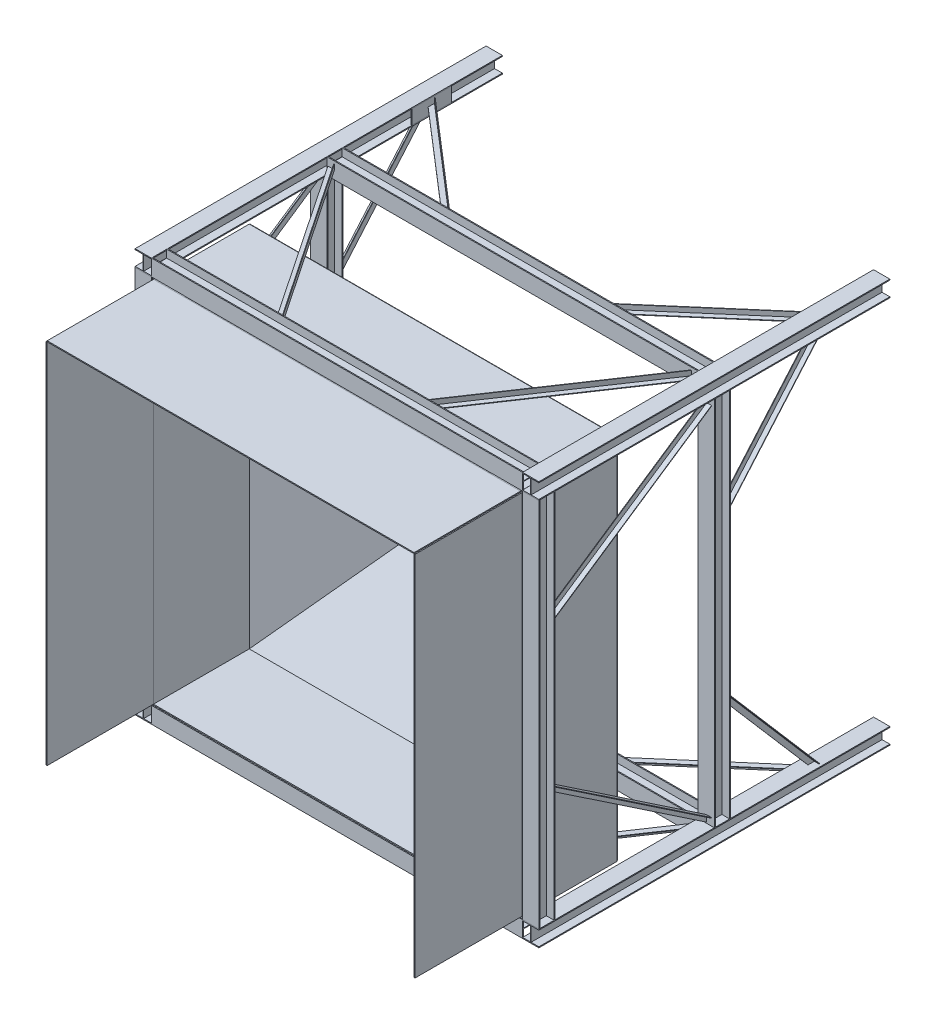
from build123d import *

# Parameters (mm, degrees)
COLUMNA_H_1_DEPTH                            = 3300
COLUMNA_H_2_DEPTH                            = 3300
COLUMNA_H_3_DEPTH                            = 3300
COLUMNA_H_4_DEPTH                            = 3300
VIGA_H_CARGA_1650_DEPTH                      = 3490
VIGA_H_CARGA_3300_DEPTH                      = 3490
CONTORNO_CIERRE_COLUMNA_CARGA_A_W            = 370
CONTORNO_CIERRE_COLUMNA_CARGA_A_H            = 135
CIERRE_COLUMNA_CARGA_A_DEPTH                 = 8
ALA_PLANA_ANGULAR_SUPERIOR_CARGA_A_DEPTH     = 5
RETORNO_ANGULAR_SUPERIOR_CARGA_A_DEPTH       = 45
ALA_PLANA_ANGULAR_INFERIOR_CARGA_A_DEPTH     = 5
RETORNO_ANGULAR_INFERIOR_CARGA_A_DEPTH       = 45
CONTORNO_CIERRE_COLUMNA_CARGA_B_W            = 370
CONTORNO_CIERRE_COLUMNA_CARGA_B_H            = 135
CIERRE_COLUMNA_CARGA_B_DEPTH                 = 8
ALA_PLANA_ANGULAR_SUPERIOR_CARGA_B_DEPTH     = 5
RETORNO_ANGULAR_SUPERIOR_CARGA_B_DEPTH       = 45
ALA_PLANA_ANGULAR_INFERIOR_CARGA_B_DEPTH     = 5
RETORNO_ANGULAR_INFERIOR_CARGA_B_DEPTH       = 45
CONTORNO_ASIENTO_SOLDADO_CARGA_W             = 2900
CONTORNO_ASIENTO_SOLDADO_CARGA_H             = 83.725
ASIENTO_SOLDADO_CARGA_DEPTH                  = 9.525
VIGA_H_FONDO_1650_DEPTH                      = 3490
VIGA_H_FONDO_3300_DEPTH                      = 3490
CONTORNO_CIERRE_COLUMNA_FONDO_A_W            = 370
CONTORNO_CIERRE_COLUMNA_FONDO_A_H            = 135
CIERRE_COLUMNA_FONDO_A_DEPTH                 = 8
ALA_PLANA_ANGULAR_SUPERIOR_FONDO_A_DEPTH     = 5
RETORNO_ANGULAR_SUPERIOR_FONDO_A_DEPTH       = 45
ALA_PLANA_ANGULAR_INFERIOR_FONDO_A_DEPTH     = 5
RETORNO_ANGULAR_INFERIOR_FONDO_A_DEPTH       = 45
CONTORNO_CIERRE_COLUMNA_FONDO_B_W            = 370
CONTORNO_CIERRE_COLUMNA_FONDO_B_H            = 135
CIERRE_COLUMNA_FONDO_B_DEPTH                 = 8
ALA_PLANA_ANGULAR_SUPERIOR_FONDO_B_DEPTH     = 5
RETORNO_ANGULAR_SUPERIOR_FONDO_B_DEPTH       = 45
ALA_PLANA_ANGULAR_INFERIOR_FONDO_B_DEPTH     = 5
RETORNO_ANGULAR_INFERIOR_FONDO_B_DEPTH       = 45
CONTORNO_ASIENTO_SOLDADO_FONDO_W             = 2900
CONTORNO_ASIENTO_SOLDADO_FONDO_H             = 83.725
ASIENTO_SOLDADO_FONDO_DEPTH                  = 9.525
VIGA_H_IZQUIERDA_1650_DEPTH                  = 3490
VIGA_H_IZQUIERDA_3300_DEPTH                  = 3490
ALA_PLANA_ANGULAR_SUPERIOR_IZQUIERDA_A_DEPTH = 5
RETORNO_ANGULAR_SUPERIOR_IZQUIERDA_A_DEPTH   = 45
ALA_PLANA_ANGULAR_INFERIOR_IZQUIERDA_A_DEPTH = 5
RETORNO_ANGULAR_INFERIOR_IZQUIERDA_A_DEPTH   = 45
ALA_PLANA_ANGULAR_SUPERIOR_IZQUIERDA_B_DEPTH = 5
RETORNO_ANGULAR_SUPERIOR_IZQUIERDA_B_DEPTH   = 45
ALA_PLANA_ANGULAR_INFERIOR_IZQUIERDA_B_DEPTH = 5
RETORNO_ANGULAR_INFERIOR_IZQUIERDA_B_DEPTH   = 45
CONTORNO_ASIENTO_SOLDADO_IZQUIERDA_W         = 83.725
CONTORNO_ASIENTO_SOLDADO_IZQUIERDA_H         = 2900
ASIENTO_SOLDADO_IZQUIERDA_DEPTH              = 9.525
VIGA_H_DERECHA_1650_DEPTH                    = 3490
VIGA_H_DERECHA_3300_DEPTH                    = 3490
ALA_PLANA_ANGULAR_SUPERIOR_DERECHA_A_DEPTH   = 5
RETORNO_ANGULAR_SUPERIOR_DERECHA_A_DEPTH     = 45
ALA_PLANA_ANGULAR_INFERIOR_DERECHA_A_DEPTH   = 5
RETORNO_ANGULAR_INFERIOR_DERECHA_A_DEPTH     = 45
ALA_PLANA_ANGULAR_SUPERIOR_DERECHA_B_DEPTH   = 5
RETORNO_ANGULAR_SUPERIOR_DERECHA_B_DEPTH     = 45
ALA_PLANA_ANGULAR_INFERIOR_DERECHA_B_DEPTH   = 5
RETORNO_ANGULAR_INFERIOR_DERECHA_B_DEPTH     = 45
CONTORNO_ASIENTO_SOLDADO_DERECHA_W           = 83.725
CONTORNO_ASIENTO_SOLDADO_DERECHA_H           = 2900
ASIENTO_SOLDADO_DERECHA_DEPTH                = 9.525
CONTORNO_COLLAR_CARGA_W                      = 3450
CONTORNO_COLLAR_CARGA_H                      = 900
COLLAR_CARGA_DEPTH                           = 9.525
EMBUDO_CARGA_DEPTH                           = 9.525
CONTORNO_COLLAR_DERECHA_W                    = 900
CONTORNO_COLLAR_DERECHA_H                    = 3450
COLLAR_DERECHA_DEPTH                         = 9.525
CONTORNO_ALER_N_DERECHA_W                    = 1000
CONTORNO_ALER_N_DERECHA_H                    = 3450
ALER_N_DERECHA_DEPTH                         = 9.525
EMBUDO_DERECHA_DEPTH                         = 9.525
CONTORNO_COLLAR_FONDO_W                      = 3450
CONTORNO_COLLAR_FONDO_H                      = 900
COLLAR_FONDO_DEPTH                           = 9.525
CONTORNO_ALER_N_FONDO_W                      = 3450
CONTORNO_ALER_N_FONDO_H                      = 1000
ALER_N_FONDO_DEPTH                           = 9.525
EMBUDO_FONDO_DEPTH                           = 9.525
CONTORNO_COLLAR_IZQUIERDA_W                  = 900
CONTORNO_COLLAR_IZQUIERDA_H                  = 3450
COLLAR_IZQUIERDA_DEPTH                       = 9.525
CONTORNO_ALER_N_IZQUIERDA_W                  = 1000
CONTORNO_ALER_N_IZQUIERDA_H                  = 3450
ALER_N_IZQUIERDA_DEPTH                       = 9.525
EMBUDO_IZQUIERDA_DEPTH                       = 9.525


with BuildPart() as part:
    # Contorno Columna H 1 → Columna H 1 (new body)
    with BuildSketch(Plane.XY):
        Polygon((-1898, -1898), (-1745, -1898), (-1745, -1889), (-1818.25, -1889), (-1818.25, -1754), (-1745, -1754), (-1745, -1745), (-1898, -1745), (-1898, -1754), (-1824.75, -1754), (-1824.75, -1889), (-1898, -1889), align=None)
    extrude(amount=COLUMNA_H_1_DEPTH)


with BuildPart() as body_2:
    # Contorno Columna H 2 → Columna H 2 (new body)
    with BuildSketch(Plane.XY):
        Polygon((-1898, 1745), (-1745, 1745), (-1745, 1754), (-1818.25, 1754), (-1818.25, 1889), (-1745, 1889), (-1745, 1898), (-1898, 1898), (-1898, 1889), (-1824.75, 1889), (-1824.75, 1754), (-1898, 1754), align=None)
    extrude(amount=COLUMNA_H_2_DEPTH)


with BuildPart() as body_3:
    # Contorno Columna H 3 → Columna H 3 (new body)
    with BuildSketch(Plane.XY):
        Polygon((1745, -1898), (1898, -1898), (1898, -1889), (1824.75, -1889), (1824.75, -1754), (1898, -1754), (1898, -1745), (1745, -1745), (1745, -1754), (1818.25, -1754), (1818.25, -1889), (1745, -1889), align=None)
    extrude(amount=COLUMNA_H_3_DEPTH)


with BuildPart() as body_4:
    # Contorno Columna H 4 → Columna H 4 (new body)
    with BuildSketch(Plane.XY):
        Polygon((1745, 1745), (1898, 1745), (1898, 1754), (1824.75, 1754), (1824.75, 1889), (1898, 1889), (1898, 1898), (1745, 1898), (1745, 1889), (1818.25, 1889), (1818.25, 1754), (1745, 1754), align=None)
    extrude(amount=COLUMNA_H_4_DEPTH)


with BuildPart() as body_5:
    # Contorno Viga H carga 1650 → Viga H carga 1650 (new body)
    with BuildSketch(Plane(origin=(-1745, 0, 0), x_dir=(0, 0, -1), z_dir=(1, 0, 0))):
        Polygon((-1497, -1745), (-1497, -1898), (-1506, -1898), (-1506, -1824.75), (-1641, -1824.75), (-1641, -1898), (-1650, -1898), (-1650, -1745), (-1641, -1745), (-1641, -1818.25), (-1506, -1818.25), (-1506, -1745), align=None)
    extrude(amount=VIGA_H_CARGA_1650_DEPTH)


with BuildPart() as body_6:
    # Contorno Viga H carga 3300 → Viga H carga 3300 (new body)
    with BuildSketch(Plane(origin=(-1745, 0, 0), x_dir=(0, 0, -1), z_dir=(1, 0, 0))):
        Polygon((-3147, -1745), (-3147, -1898), (-3156, -1898), (-3156, -1824.75), (-3291, -1824.75), (-3291, -1898), (-3300, -1898), (-3300, -1745), (-3291, -1745), (-3291, -1818.25), (-3156, -1818.25), (-3156, -1745), align=None)
    extrude(amount=VIGA_H_CARGA_3300_DEPTH)


with BuildPart() as body_7:
    # Contorno Cierre columna carga A → Cierre columna carga A (new body)
    with BuildSketch(Plane(origin=(-1745, 0, 0), x_dir=(0, 0, -1), z_dir=(1, 0, 0))):
        with Locations((-665, -1821.5)):
            Rectangle(CONTORNO_CIERRE_COLUMNA_CARGA_A_W, CONTORNO_CIERRE_COLUMNA_CARGA_A_H)
    extrude(amount=-CIERRE_COLUMNA_CARGA_A_DEPTH)


with BuildPart() as body_8:
    # Contorno Ala plana Angular superior carg → Ala plana Angular superior carga A (new body)
    with BuildSketch(Plane(origin=(0, -1821.5, 0), x_dir=(1, 0, 0), z_dir=(0, 1, 0))):
        Polygon((-1674.870108064, -1650), (-1735.129891936, -1650), (-728.129891936, -3147), (-667.870108064, -3147), align=None)
    extrude(amount=-ALA_PLANA_ANGULAR_SUPERIOR_CARGA_A_DEPTH)


with BuildPart() as body_9:
    # Contorno Retorno Angular superior carga → Retorno Angular superior carga A (new body)
    with BuildSketch(Plane(origin=(0, -1826.5, 0), x_dir=(1, 0, 0), z_dir=(0, 1, 0))):
        Polygon((-1674.870108064, -1650), (-1680.896086451, -1650), (-673.896086451, -3147), (-667.870108064, -3147), align=None)
    extrude(amount=-RETORNO_ANGULAR_SUPERIOR_CARGA_A_DEPTH)


with BuildPart() as body_8_1:
    add(body_8.part)

    # Angular superior carga A: union body 9
    add(body_9.part)


with BuildPart() as body_9_2:
    # Contorno Ala plana Angular inferior carg → Ala plana Angular inferior carga A (new body)
    with BuildSketch(Plane(origin=(0, -1821.5, 0), x_dir=(1, 0, 0), z_dir=(0, 1, 0))):
        Polygon((-1745, -631.991026401), (-1745, -698.008973599), (-818.285648465, -1497), (-741.714351535, -1497), align=None)
    extrude(amount=-ALA_PLANA_ANGULAR_INFERIOR_CARGA_A_DEPTH)


with BuildPart() as body_10:
    # Contorno Retorno Angular inferior carga → Retorno Angular inferior carga A (new body)
    with BuildSketch(Plane(origin=(0, -1826.5, 0), x_dir=(1, 0, 0), z_dir=(0, 1, 0))):
        Polygon((-1745, -631.991026401), (-1745, -638.592821121), (-749.371481228, -1497), (-741.714351535, -1497), align=None)
    extrude(amount=-RETORNO_ANGULAR_INFERIOR_CARGA_A_DEPTH)


with BuildPart() as body_9_2_1:
    add(body_9_2.part)

    # Angular inferior carga A: union body 10
    add(body_10.part)


with BuildPart() as body_10_2:
    # Contorno Cierre columna carga B → Cierre columna carga B (new body)
    with BuildSketch(Plane(origin=(1745, 0, 0), x_dir=(0, 0, -1), z_dir=(1, 0, 0))):
        with Locations((-665, -1821.5)):
            Rectangle(CONTORNO_CIERRE_COLUMNA_CARGA_B_W, CONTORNO_CIERRE_COLUMNA_CARGA_B_H)
    extrude(amount=CIERRE_COLUMNA_CARGA_B_DEPTH)


with BuildPart() as body_11:
    # Contorno Ala plana Angular superior  2 → Ala plana Angular superior carga B (new body)
    with BuildSketch(Plane(origin=(0, -1821.5, 0), x_dir=(1, 0, 0), z_dir=(0, 1, 0))):
        Polygon((1674.870108064, -1650), (1735.129891936, -1650), (728.129891936, -3147), (667.870108064, -3147), align=None)
    extrude(amount=-ALA_PLANA_ANGULAR_SUPERIOR_CARGA_B_DEPTH)


with BuildPart() as body_12:
    # Contorno Retorno Angular superior ca 2 → Retorno Angular superior carga B (new body)
    with BuildSketch(Plane(origin=(0, -1826.5, 0), x_dir=(1, 0, 0), z_dir=(0, 1, 0))):
        Polygon((1674.870108064, -1650), (1680.896086451, -1650), (673.896086451, -3147), (667.870108064, -3147), align=None)
    extrude(amount=-RETORNO_ANGULAR_SUPERIOR_CARGA_B_DEPTH)


with BuildPart() as body_11_1:
    add(body_11.part)

    # Angular superior carga B: union body 12
    add(body_12.part)


with BuildPart() as body_12_2:
    # Contorno Ala plana Angular inferior  2 → Ala plana Angular inferior carga B (new body)
    with BuildSketch(Plane(origin=(0, -1821.5, 0), x_dir=(1, 0, 0), z_dir=(0, 1, 0))):
        Polygon((1745, -631.991026401), (1745, -698.008973599), (818.285648465, -1497), (741.714351535, -1497), align=None)
    extrude(amount=-ALA_PLANA_ANGULAR_INFERIOR_CARGA_B_DEPTH)


with BuildPart() as body_13:
    # Contorno Retorno Angular inferior ca 2 → Retorno Angular inferior carga B (new body)
    with BuildSketch(Plane(origin=(0, -1826.5, 0), x_dir=(1, 0, 0), z_dir=(0, 1, 0))):
        Polygon((1745, -631.991026401), (1745, -638.592821121), (749.371481228, -1497), (741.714351535, -1497), align=None)
    extrude(amount=-RETORNO_ANGULAR_INFERIOR_CARGA_B_DEPTH)


with BuildPart() as body_12_2_1:
    add(body_12_2.part)

    # Angular inferior carga B: union body 13
    add(body_13.part)


with BuildPart() as body_13_2:
    # Contorno Asiento soldado carga → Asiento soldado carga (new body)
    with BuildSketch(Plane.XY.offset(3281.475)):
        with Locations((0, -1776.3875)):
            Rectangle(CONTORNO_ASIENTO_SOLDADO_CARGA_W, CONTORNO_ASIENTO_SOLDADO_CARGA_H)
    extrude(amount=ASIENTO_SOLDADO_CARGA_DEPTH)


with BuildPart() as body_14:
    # Contorno Viga H fondo 1650 → Viga H fondo 1650 (new body)
    with BuildSketch(Plane(origin=(-1745, 0, 0), x_dir=(0, 0, -1), z_dir=(1, 0, 0))):
        Polygon((-1497, 1745), (-1497, 1898), (-1506, 1898), (-1506, 1824.75), (-1641, 1824.75), (-1641, 1898), (-1650, 1898), (-1650, 1745), (-1641, 1745), (-1641, 1818.25), (-1506, 1818.25), (-1506, 1745), align=None)
    extrude(amount=VIGA_H_FONDO_1650_DEPTH)


with BuildPart() as body_15:
    # Contorno Viga H fondo 3300 → Viga H fondo 3300 (new body)
    with BuildSketch(Plane(origin=(-1745, 0, 0), x_dir=(0, 0, -1), z_dir=(1, 0, 0))):
        Polygon((-3147, 1745), (-3147, 1898), (-3156, 1898), (-3156, 1824.75), (-3291, 1824.75), (-3291, 1898), (-3300, 1898), (-3300, 1745), (-3291, 1745), (-3291, 1818.25), (-3156, 1818.25), (-3156, 1745), align=None)
    extrude(amount=VIGA_H_FONDO_3300_DEPTH)


with BuildPart() as body_16:
    # Contorno Cierre columna fondo A → Cierre columna fondo A (new body)
    with BuildSketch(Plane(origin=(-1745, 0, 0), x_dir=(0, 0, -1), z_dir=(1, 0, 0))):
        with Locations((-665, 1821.5)):
            Rectangle(CONTORNO_CIERRE_COLUMNA_FONDO_A_W, CONTORNO_CIERRE_COLUMNA_FONDO_A_H)
    extrude(amount=-CIERRE_COLUMNA_FONDO_A_DEPTH)


with BuildPart() as body_17:
    # Contorno Ala plana Angular superior fond → Ala plana Angular superior fondo A (new body)
    with BuildSketch(Plane(origin=(0, 1821.5, 0), x_dir=(1, 0, 0), z_dir=(0, 1, 0))):
        Polygon((-1674.870108064, -1650), (-1735.129891936, -1650), (-728.129891936, -3147), (-667.870108064, -3147), align=None)
    extrude(amount=ALA_PLANA_ANGULAR_SUPERIOR_FONDO_A_DEPTH)


with BuildPart() as body_18:
    # Contorno Retorno Angular superior fondo → Retorno Angular superior fondo A (new body)
    with BuildSketch(Plane(origin=(0, 1826.5, 0), x_dir=(1, 0, 0), z_dir=(0, 1, 0))):
        Polygon((-1674.870108064, -1650), (-1680.896086451, -1650), (-673.896086451, -3147), (-667.870108064, -3147), align=None)
    extrude(amount=RETORNO_ANGULAR_SUPERIOR_FONDO_A_DEPTH)


with BuildPart() as body_17_1:
    add(body_17.part)

    # Angular superior fondo A: union body 18
    add(body_18.part)


with BuildPart() as body_18_2:
    # Contorno Ala plana Angular inferior fond → Ala plana Angular inferior fondo A (new body)
    with BuildSketch(Plane(origin=(0, 1821.5, 0), x_dir=(1, 0, 0), z_dir=(0, 1, 0))):
        Polygon((-1745, -631.991026401), (-1745, -698.008973599), (-818.285648465, -1497), (-741.714351535, -1497), align=None)
    extrude(amount=ALA_PLANA_ANGULAR_INFERIOR_FONDO_A_DEPTH)


with BuildPart() as body_19:
    # Contorno Retorno Angular inferior fondo → Retorno Angular inferior fondo A (new body)
    with BuildSketch(Plane(origin=(0, 1826.5, 0), x_dir=(1, 0, 0), z_dir=(0, 1, 0))):
        Polygon((-1745, -631.991026401), (-1745, -638.592821121), (-749.371481228, -1497), (-741.714351535, -1497), align=None)
    extrude(amount=RETORNO_ANGULAR_INFERIOR_FONDO_A_DEPTH)


with BuildPart() as body_18_2_1:
    add(body_18_2.part)

    # Angular inferior fondo A: union body 19
    add(body_19.part)


with BuildPart() as body_19_2:
    # Contorno Cierre columna fondo B → Cierre columna fondo B (new body)
    with BuildSketch(Plane(origin=(1745, 0, 0), x_dir=(0, 0, -1), z_dir=(1, 0, 0))):
        with Locations((-665, 1821.5)):
            Rectangle(CONTORNO_CIERRE_COLUMNA_FONDO_B_W, CONTORNO_CIERRE_COLUMNA_FONDO_B_H)
    extrude(amount=CIERRE_COLUMNA_FONDO_B_DEPTH)


with BuildPart() as body_20:
    # Contorno Ala plana Angular superior  3 → Ala plana Angular superior fondo B (new body)
    with BuildSketch(Plane(origin=(0, 1821.5, 0), x_dir=(1, 0, 0), z_dir=(0, 1, 0))):
        Polygon((1674.870108064, -1650), (1735.129891936, -1650), (728.129891936, -3147), (667.870108064, -3147), align=None)
    extrude(amount=ALA_PLANA_ANGULAR_SUPERIOR_FONDO_B_DEPTH)


with BuildPart() as body_21:
    # Contorno Retorno Angular superior fo 2 → Retorno Angular superior fondo B (new body)
    with BuildSketch(Plane(origin=(0, 1826.5, 0), x_dir=(1, 0, 0), z_dir=(0, 1, 0))):
        Polygon((1674.870108064, -1650), (1680.896086451, -1650), (673.896086451, -3147), (667.870108064, -3147), align=None)
    extrude(amount=RETORNO_ANGULAR_SUPERIOR_FONDO_B_DEPTH)


with BuildPart() as body_20_1:
    add(body_20.part)

    # Angular superior fondo B: union body 21
    add(body_21.part)


with BuildPart() as body_21_2:
    # Contorno Ala plana Angular inferior  3 → Ala plana Angular inferior fondo B (new body)
    with BuildSketch(Plane(origin=(0, 1821.5, 0), x_dir=(1, 0, 0), z_dir=(0, 1, 0))):
        Polygon((1745, -631.991026401), (1745, -698.008973599), (818.285648465, -1497), (741.714351535, -1497), align=None)
    extrude(amount=ALA_PLANA_ANGULAR_INFERIOR_FONDO_B_DEPTH)


with BuildPart() as body_22:
    # Contorno Retorno Angular inferior fo 2 → Retorno Angular inferior fondo B (new body)
    with BuildSketch(Plane(origin=(0, 1826.5, 0), x_dir=(1, 0, 0), z_dir=(0, 1, 0))):
        Polygon((1745, -631.991026401), (1745, -638.592821121), (749.371481228, -1497), (741.714351535, -1497), align=None)
    extrude(amount=RETORNO_ANGULAR_INFERIOR_FONDO_B_DEPTH)


with BuildPart() as body_21_2_1:
    add(body_21_2.part)

    # Angular inferior fondo B: union body 22
    add(body_22.part)


with BuildPart() as body_22_2:
    # Contorno Asiento soldado fondo → Asiento soldado fondo (new body)
    with BuildSketch(Plane.XY.offset(3281.475)):
        with Locations((0, 1776.3875)):
            Rectangle(CONTORNO_ASIENTO_SOLDADO_FONDO_W, CONTORNO_ASIENTO_SOLDADO_FONDO_H)
    extrude(amount=ASIENTO_SOLDADO_FONDO_DEPTH)


with BuildPart() as body_23:
    # Contorno Viga H izquierda 1650 → Viga H izquierda 1650 (new body)
    with BuildSketch(Plane(origin=(0, -1745, 0), x_dir=(1, 0, 0), z_dir=(0, 1, 0))):
        Polygon((-1745, -1497), (-1898, -1497), (-1898, -1506), (-1824.75, -1506), (-1824.75, -1641), (-1898, -1641), (-1898, -1650), (-1745, -1650), (-1745, -1641), (-1818.25, -1641), (-1818.25, -1506), (-1745, -1506), align=None)
    extrude(amount=VIGA_H_IZQUIERDA_1650_DEPTH)


with BuildPart() as body_24:
    # Contorno Viga H izquierda 3300 → Viga H izquierda 3300 (new body)
    with BuildSketch(Plane(origin=(0, -1745, 0), x_dir=(1, 0, 0), z_dir=(0, 1, 0))):
        Polygon((-1745, -3147), (-1898, -3147), (-1898, -3156), (-1824.75, -3156), (-1824.75, -3291), (-1898, -3291), (-1898, -3300), (-1745, -3300), (-1745, -3291), (-1818.25, -3291), (-1818.25, -3156), (-1745, -3156), align=None)
    extrude(amount=VIGA_H_IZQUIERDA_3300_DEPTH)


with BuildPart() as body_25:
    # Contorno Ala plana Angular superior izqu → Ala plana Angular superior izquierda A (new body)
    with BuildSketch(Plane(origin=(-1821.5, 0, 0), x_dir=(0, 0, -1), z_dir=(1, 0, 0))):
        Polygon((-1650, -1674.870108064), (-1650, -1735.129891936), (-3147, -728.129891936), (-3147, -667.870108064), align=None)
    extrude(amount=-ALA_PLANA_ANGULAR_SUPERIOR_IZQUIERDA_A_DEPTH)


with BuildPart() as body_26:
    # Contorno Retorno Angular superior izquie → Retorno Angular superior izquierda A (new body)
    with BuildSketch(Plane(origin=(-1826.5, 0, 0), x_dir=(0, 0, -1), z_dir=(1, 0, 0))):
        Polygon((-1650, -1674.870108064), (-1650, -1680.896086451), (-3147, -673.896086451), (-3147, -667.870108064), align=None)
    extrude(amount=-RETORNO_ANGULAR_SUPERIOR_IZQUIERDA_A_DEPTH)


with BuildPart() as body_25_1:
    add(body_25.part)

    # Angular superior izquierda A: union body 26
    add(body_26.part)


with BuildPart() as body_26_2:
    # Contorno Ala plana Angular inferior izqu → Ala plana Angular inferior izquierda A (new body)
    with BuildSketch(Plane(origin=(-1821.5, 0, 0), x_dir=(0, 0, -1), z_dir=(1, 0, 0))):
        Polygon((-631.991026401, -1745), (-698.008973599, -1745), (-1497, -818.285648465), (-1497, -741.714351535), align=None)
    extrude(amount=-ALA_PLANA_ANGULAR_INFERIOR_IZQUIERDA_A_DEPTH)


with BuildPart() as body_27:
    # Contorno Retorno Angular inferior izquie → Retorno Angular inferior izquierda A (new body)
    with BuildSketch(Plane(origin=(-1826.5, 0, 0), x_dir=(0, 0, -1), z_dir=(1, 0, 0))):
        Polygon((-631.991026401, -1745), (-638.592821121, -1745), (-1497, -749.371481228), (-1497, -741.714351535), align=None)
    extrude(amount=-RETORNO_ANGULAR_INFERIOR_IZQUIERDA_A_DEPTH)


with BuildPart() as body_26_2_1:
    add(body_26_2.part)

    # Angular inferior izquierda A: union body 27
    add(body_27.part)


with BuildPart() as body_27_2:
    # Contorno Ala plana Angular superior  4 → Ala plana Angular superior izquierda B (new body)
    with BuildSketch(Plane(origin=(-1821.5, 0, 0), x_dir=(0, 0, -1), z_dir=(1, 0, 0))):
        Polygon((-1650, 1674.870108064), (-1650, 1735.129891936), (-3147, 728.129891936), (-3147, 667.870108064), align=None)
    extrude(amount=-ALA_PLANA_ANGULAR_SUPERIOR_IZQUIERDA_B_DEPTH)


with BuildPart() as body_28:
    # Contorno Retorno Angular superior iz 2 → Retorno Angular superior izquierda B (new body)
    with BuildSketch(Plane(origin=(-1826.5, 0, 0), x_dir=(0, 0, -1), z_dir=(1, 0, 0))):
        Polygon((-1650, 1674.870108064), (-1650, 1680.896086451), (-3147, 673.896086451), (-3147, 667.870108064), align=None)
    extrude(amount=-RETORNO_ANGULAR_SUPERIOR_IZQUIERDA_B_DEPTH)


with BuildPart() as body_27_2_1:
    add(body_27_2.part)

    # Angular superior izquierda B: union body 28
    add(body_28.part)


with BuildPart() as body_28_2:
    # Contorno Ala plana Angular inferior  4 → Ala plana Angular inferior izquierda B (new body)
    with BuildSketch(Plane(origin=(-1821.5, 0, 0), x_dir=(0, 0, -1), z_dir=(1, 0, 0))):
        Polygon((-631.991026401, 1745), (-698.008973599, 1745), (-1497, 818.285648465), (-1497, 741.714351535), align=None)
    extrude(amount=-ALA_PLANA_ANGULAR_INFERIOR_IZQUIERDA_B_DEPTH)


with BuildPart() as body_29:
    # Contorno Retorno Angular inferior iz 2 → Retorno Angular inferior izquierda B (new body)
    with BuildSketch(Plane(origin=(-1826.5, 0, 0), x_dir=(0, 0, -1), z_dir=(1, 0, 0))):
        Polygon((-631.991026401, 1745), (-638.592821121, 1745), (-1497, 749.371481228), (-1497, 741.714351535), align=None)
    extrude(amount=-RETORNO_ANGULAR_INFERIOR_IZQUIERDA_B_DEPTH)


with BuildPart() as body_28_2_1:
    add(body_28_2.part)

    # Angular inferior izquierda B: union body 29
    add(body_29.part)


with BuildPart() as body_29_2:
    # Contorno Asiento soldado izquierda → Asiento soldado izquierda (new body)
    with BuildSketch(Plane.XY.offset(3281.475)):
        with Locations((-1776.3875, 0)):
            Rectangle(CONTORNO_ASIENTO_SOLDADO_IZQUIERDA_W, CONTORNO_ASIENTO_SOLDADO_IZQUIERDA_H)
    extrude(amount=ASIENTO_SOLDADO_IZQUIERDA_DEPTH)


with BuildPart() as body_30:
    # Contorno Viga H derecha 1650 → Viga H derecha 1650 (new body)
    with BuildSketch(Plane(origin=(0, -1745, 0), x_dir=(1, 0, 0), z_dir=(0, 1, 0))):
        Polygon((1745, -1497), (1898, -1497), (1898, -1506), (1824.75, -1506), (1824.75, -1641), (1898, -1641), (1898, -1650), (1745, -1650), (1745, -1641), (1818.25, -1641), (1818.25, -1506), (1745, -1506), align=None)
    extrude(amount=VIGA_H_DERECHA_1650_DEPTH)


with BuildPart() as body_31:
    # Contorno Viga H derecha 3300 → Viga H derecha 3300 (new body)
    with BuildSketch(Plane(origin=(0, -1745, 0), x_dir=(1, 0, 0), z_dir=(0, 1, 0))):
        Polygon((1745, -3147), (1898, -3147), (1898, -3156), (1824.75, -3156), (1824.75, -3291), (1898, -3291), (1898, -3300), (1745, -3300), (1745, -3291), (1818.25, -3291), (1818.25, -3156), (1745, -3156), align=None)
    extrude(amount=VIGA_H_DERECHA_3300_DEPTH)


with BuildPart() as body_32:
    # Contorno Ala plana Angular superior dere → Ala plana Angular superior derecha A (new body)
    with BuildSketch(Plane(origin=(1821.5, 0, 0), x_dir=(0, 0, -1), z_dir=(1, 0, 0))):
        Polygon((-1650, -1674.870108064), (-1650, -1735.129891936), (-3147, -728.129891936), (-3147, -667.870108064), align=None)
    extrude(amount=ALA_PLANA_ANGULAR_SUPERIOR_DERECHA_A_DEPTH)


with BuildPart() as body_33:
    # Contorno Retorno Angular superior derech → Retorno Angular superior derecha A (new body)
    with BuildSketch(Plane(origin=(1826.5, 0, 0), x_dir=(0, 0, -1), z_dir=(1, 0, 0))):
        Polygon((-1650, -1674.870108064), (-1650, -1680.896086451), (-3147, -673.896086451), (-3147, -667.870108064), align=None)
    extrude(amount=RETORNO_ANGULAR_SUPERIOR_DERECHA_A_DEPTH)


with BuildPart() as body_32_1:
    add(body_32.part)

    # Angular superior derecha A: union body 33
    add(body_33.part)


with BuildPart() as body_33_2:
    # Contorno Ala plana Angular inferior dere → Ala plana Angular inferior derecha A (new body)
    with BuildSketch(Plane(origin=(1821.5, 0, 0), x_dir=(0, 0, -1), z_dir=(1, 0, 0))):
        Polygon((-631.991026401, -1745), (-698.008973599, -1745), (-1497, -818.285648465), (-1497, -741.714351535), align=None)
    extrude(amount=ALA_PLANA_ANGULAR_INFERIOR_DERECHA_A_DEPTH)


with BuildPart() as body_34:
    # Contorno Retorno Angular inferior derech → Retorno Angular inferior derecha A (new body)
    with BuildSketch(Plane(origin=(1826.5, 0, 0), x_dir=(0, 0, -1), z_dir=(1, 0, 0))):
        Polygon((-631.991026401, -1745), (-638.592821121, -1745), (-1497, -749.371481228), (-1497, -741.714351535), align=None)
    extrude(amount=RETORNO_ANGULAR_INFERIOR_DERECHA_A_DEPTH)


with BuildPart() as body_33_2_1:
    add(body_33_2.part)

    # Angular inferior derecha A: union body 34
    add(body_34.part)


with BuildPart() as body_34_2:
    # Contorno Ala plana Angular superior  5 → Ala plana Angular superior derecha B (new body)
    with BuildSketch(Plane(origin=(1821.5, 0, 0), x_dir=(0, 0, -1), z_dir=(1, 0, 0))):
        Polygon((-1650, 1674.870108064), (-1650, 1735.129891936), (-3147, 728.129891936), (-3147, 667.870108064), align=None)
    extrude(amount=ALA_PLANA_ANGULAR_SUPERIOR_DERECHA_B_DEPTH)


with BuildPart() as body_35:
    # Contorno Retorno Angular superior de 2 → Retorno Angular superior derecha B (new body)
    with BuildSketch(Plane(origin=(1826.5, 0, 0), x_dir=(0, 0, -1), z_dir=(1, 0, 0))):
        Polygon((-1650, 1674.870108064), (-1650, 1680.896086451), (-3147, 673.896086451), (-3147, 667.870108064), align=None)
    extrude(amount=RETORNO_ANGULAR_SUPERIOR_DERECHA_B_DEPTH)


with BuildPart() as body_34_2_1:
    add(body_34_2.part)

    # Angular superior derecha B: union body 35
    add(body_35.part)


with BuildPart() as body_35_2:
    # Contorno Ala plana Angular inferior  5 → Ala plana Angular inferior derecha B (new body)
    with BuildSketch(Plane(origin=(1821.5, 0, 0), x_dir=(0, 0, -1), z_dir=(1, 0, 0))):
        Polygon((-631.991026401, 1745), (-698.008973599, 1745), (-1497, 818.285648465), (-1497, 741.714351535), align=None)
    extrude(amount=ALA_PLANA_ANGULAR_INFERIOR_DERECHA_B_DEPTH)


with BuildPart() as body_36:
    # Contorno Retorno Angular inferior de 2 → Retorno Angular inferior derecha B (new body)
    with BuildSketch(Plane(origin=(1826.5, 0, 0), x_dir=(0, 0, -1), z_dir=(1, 0, 0))):
        Polygon((-631.991026401, 1745), (-638.592821121, 1745), (-1497, 749.371481228), (-1497, 741.714351535), align=None)
    extrude(amount=RETORNO_ANGULAR_INFERIOR_DERECHA_B_DEPTH)


with BuildPart() as body_35_2_1:
    add(body_35_2.part)

    # Angular inferior derecha B: union body 36
    add(body_36.part)


with BuildPart() as body_36_2:
    # Contorno Asiento soldado derecha → Asiento soldado derecha (new body)
    with BuildSketch(Plane.XY.offset(3281.475)):
        with Locations((1776.3875, 0)):
            Rectangle(CONTORNO_ASIENTO_SOLDADO_DERECHA_W, CONTORNO_ASIENTO_SOLDADO_DERECHA_H)
    extrude(amount=ASIENTO_SOLDADO_DERECHA_DEPTH)


with BuildPart() as body_37:
    # Contorno Collar carga → Collar carga (new body)
    with BuildSketch(Plane(origin=(0, -1725, 0), x_dir=(1, 0, 0), z_dir=(0, 1, 0))):
        with Locations((0, -2850)):
            Rectangle(CONTORNO_COLLAR_CARGA_W, CONTORNO_COLLAR_CARGA_H)
    extrude(amount=-COLLAR_CARGA_DEPTH)


with BuildPart() as body_38:
    # Contorno Embudo carga → Embudo carga (new body)
    with BuildSketch(Plane(origin=(0, 601.095747456, 995.564831724), x_dir=(1, 0, 0), z_dir=(0, 0.5168690990339176, 0.8560644452749256))):
        Polygon((-1725, -2717.197005781), (1725, -2717.197005781), (600, -1169.416336564), (-600, -1169.416336564), align=None)
    extrude(amount=-EMBUDO_CARGA_DEPTH)


with BuildPart() as body_39:
    # Contorno Collar derecha → Collar derecha (new body)
    with BuildSketch(Plane(origin=(1725, 0, 0), x_dir=(0, 0, -1), z_dir=(1, 0, 0))):
        with Locations((-2850, 0)):
            Rectangle(CONTORNO_COLLAR_DERECHA_W, CONTORNO_COLLAR_DERECHA_H)
    extrude(amount=COLLAR_DERECHA_DEPTH)


with BuildPart() as body_40:
    # Contorno Alerón derecha → Alerón derecha (new body)
    with BuildSketch(Plane(origin=(1725, 0, 0), x_dir=(0, 0, -1), z_dir=(1, 0, 0))):
        with Locations((-3800, 0)):
            Rectangle(CONTORNO_ALER_N_DERECHA_W, CONTORNO_ALER_N_DERECHA_H)
    extrude(amount=ALER_N_DERECHA_DEPTH)


with BuildPart() as body_41:
    # Contorno Embudo derecha → Embudo derecha (new body)
    with BuildSketch(Plane(origin=(-554.148901279, 0, 779.271892424), x_dir=(-0.814955324568755, 0, -0.5795237863600037), z_dir=(0.5795237863600037, 0, -0.814955324568755))):
        Polygon((-2796.655022145, -1725), (-2796.655022145, 1725), (-1416.211252917, 400), (-1416.211252917, -400), align=None)
    extrude(amount=EMBUDO_DERECHA_DEPTH)


with BuildPart() as body_42:
    # Contorno Collar fondo → Collar fondo (new body)
    with BuildSketch(Plane(origin=(0, 1725, 0), x_dir=(1, 0, 0), z_dir=(0, 1, 0))):
        with Locations((0, -2850)):
            Rectangle(CONTORNO_COLLAR_FONDO_W, CONTORNO_COLLAR_FONDO_H)
    extrude(amount=COLLAR_FONDO_DEPTH)


with BuildPart() as body_43:
    # Contorno Alerón fondo → Alerón fondo (new body)
    with BuildSketch(Plane(origin=(0, 1725, 0), x_dir=(1, 0, 0), z_dir=(0, 1, 0))):
        with Locations((0, -3800)):
            Rectangle(CONTORNO_ALER_N_FONDO_W, CONTORNO_ALER_N_FONDO_H)
    extrude(amount=ALER_N_FONDO_DEPTH)


with BuildPart() as body_44:
    # Contorno Embudo fondo → Embudo fondo (new body)
    with BuildSketch(Plane(origin=(0, -601.095747456, 995.564831724), x_dir=(-1, 0, 0), z_dir=(0, 0.5168690990339176, -0.8560644452749256))):
        Polygon((-1725, 2717.197005781), (1725, 2717.197005781), (600, 1169.416336564), (-600, 1169.416336564), align=None)
    extrude(amount=EMBUDO_FONDO_DEPTH)


with BuildPart() as body_45:
    # Contorno Collar izquierda → Collar izquierda (new body)
    with BuildSketch(Plane(origin=(-1725, 0, 0), x_dir=(0, 0, -1), z_dir=(1, 0, 0))):
        with Locations((-2850, 0)):
            Rectangle(CONTORNO_COLLAR_IZQUIERDA_W, CONTORNO_COLLAR_IZQUIERDA_H)
    extrude(amount=-COLLAR_IZQUIERDA_DEPTH)


with BuildPart() as body_46:
    # Contorno Alerón izquierda → Alerón izquierda (new body)
    with BuildSketch(Plane(origin=(-1725, 0, 0), x_dir=(0, 0, -1), z_dir=(1, 0, 0))):
        with Locations((-3800, 0)):
            Rectangle(CONTORNO_ALER_N_IZQUIERDA_W, CONTORNO_ALER_N_IZQUIERDA_H)
    extrude(amount=-ALER_N_IZQUIERDA_DEPTH)


with BuildPart() as body_47:
    # Contorno Embudo izquierda → Embudo izquierda (new body)
    with BuildSketch(Plane(origin=(554.148901279, 0, 779.271892424), x_dir=(0.8149553245687554, 0, -0.5795237863600032), z_dir=(0.5795237863600031, 0, 0.8149553245687553))):
        Polygon((-2796.655022145, 1725), (-2796.655022145, -1725), (-1416.211252917, -400), (-1416.211252917, 400), align=None)
    extrude(amount=-EMBUDO_IZQUIERDA_DEPTH)


solid = Compound([part.part, body_2.part, body_3.part, body_4.part, body_5.part, body_6.part, body_7.part, body_8_1.part, body_9_2_1.part, body_10_2.part, body_11_1.part, body_12_2_1.part, body_13_2.part, body_14.part, body_15.part, body_16.part, body_17_1.part, body_18_2_1.part, body_19_2.part, body_20_1.part, body_21_2_1.part, body_22_2.part, body_23.part, body_24.part, body_25_1.part, body_26_2_1.part, body_27_2_1.part, body_28_2_1.part, body_29_2.part, body_30.part, body_31.part, body_32_1.part, body_33_2_1.part, body_34_2_1.part, body_35_2_1.part, body_36_2.part, body_37.part, body_38.part, body_39.part, body_40.part, body_41.part, body_42.part, body_43.part, body_44.part, body_45.part, body_46.part, body_47.part])
